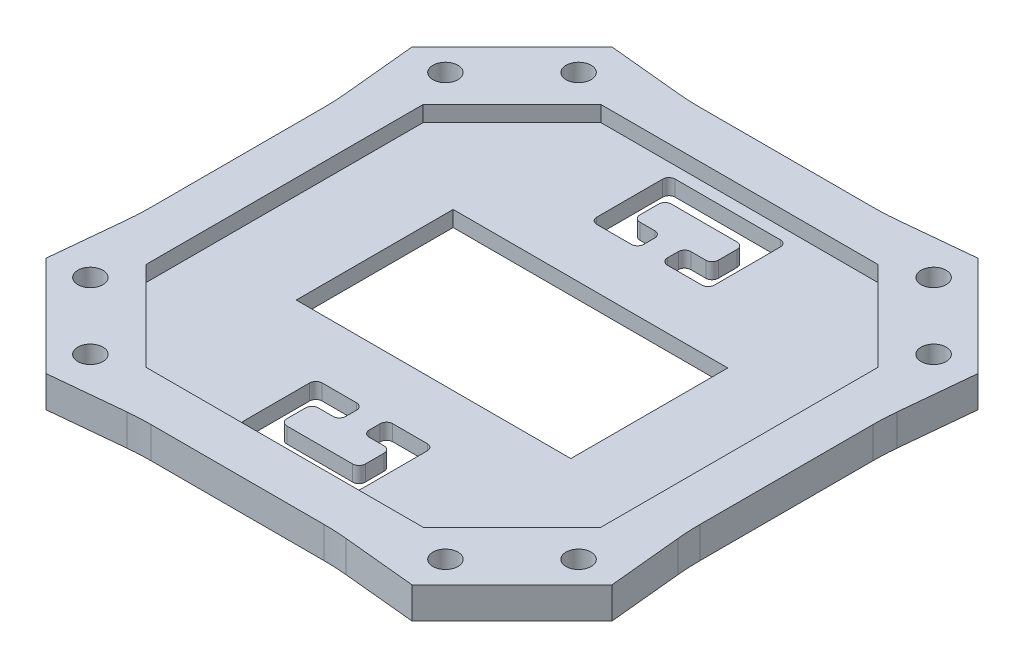
from build123d import *

# Parameters (mm, degrees)
SKETCH1_R           = 1.6
BOSS_EXTRUDE1_DEPTH = 4
CUT_EXTRUDE1_DEPTH  = 2
FILLET2_R           = 30
CUT_EXTRUDE5_DEPTH  = 52.039200621
SKETCH7_W           = 35
SKETCH7_H           = 20
CUT_EXTRUDE6_DEPTH  = 52.039200621


with BuildPart() as part:
    # Sketch1 → Boss-Extrude1 (new body)
    with BuildSketch(Plane(origin=(0, 0, 0), x_dir=(1, 0, 0), z_dir=(0, 1, 0))):
        Polygon((-12.5, 35), (12.5, 35), (23.334523779, 36.062445841), (36.062445841, 23.334523779), (35, 12.5), (35, -12.5), (36.062445841, -23.334523779), (23.334523779, -36.062445841), (12.5, -35), (-12.5, -35), (-23.334523779, -36.062445841), (-36.06244584, -23.334523779), (-35, -12.5), (-35, 12.5), (-36.062445841, 23.334523779), (-23.334523779, 36.062445841), align=None)
        with Locations(Location((22.627416998, 31.112698372, 0), (0, 0, 270))):
            Circle(SKETCH1_R, mode=Mode.SUBTRACT)
        with Locations(Location((31.112698372, 22.627416998, 0), (0, 0, 270))):
            Circle(SKETCH1_R, mode=Mode.SUBTRACT)
        with Locations(Location((22.627416998, -31.112698372, 0), (0, 0, 270))):
            Circle(SKETCH1_R, mode=Mode.SUBTRACT)
        with Locations(Location((31.112698372, -22.627416998, 0), (0, 0, 270))):
            Circle(SKETCH1_R, mode=Mode.SUBTRACT)
        with Locations(Location((-31.112698372, -22.627416998, 0), (0, 0, 270))):
            Circle(SKETCH1_R, mode=Mode.SUBTRACT)
        with Locations(Location((-22.627416998, -31.112698372, 0), (0, 0, 270))):
            Circle(SKETCH1_R, mode=Mode.SUBTRACT)
        with Locations(Location((-22.627416998, 31.112698372, 0), (0, 0, 270))):
            Circle(SKETCH1_R, mode=Mode.SUBTRACT)
        with Locations(Location((-31.112698372, 22.627416998, 0), (0, 0, 270))):
            Circle(SKETCH1_R, mode=Mode.SUBTRACT)
    extrude(amount=BOSS_EXTRUDE1_DEPTH)

    # Sketch2 → Cut-Extrude1 (cut)
    with BuildSketch(Plane(origin=(0, 4, 0), x_dir=(1, 0, 0), z_dir=(0, 1, 0))):
        Polygon((-17.669047558, 29), (17.669047558, 29), (29, 17.669047558), (29, -17.669047558), (17.669047558, -29), (-17.669047558, -29), (-29, -17.669047558), (-29, 17.669047558), align=None)
    extrude(amount=-CUT_EXTRUDE1_DEPTH, mode=Mode.SUBTRACT)

    # Fillet2
    # the kernel refuses this fillet: 30 mm, written as the material it adds along each edge
    with BuildSketch(Plane(origin=(-12.5, 0, -35), x_dir=(1, 0, 0), z_dir=(0, 1, 0))) as fillet2_piece_1:
        with BuildLine():
            CenterArc((FILLET2_R * 0.0489132680017, FILLET2_R), FILLET2_R, 264.399415997, 5.600584003)
            Line((-FILLET2_R * 0.0486797758843, FILLET2_R * 0.00477359471069), (0, 0))
            Line((0, 0), (FILLET2_R * 0.0489132680017, 0))
        make_face()
    extrude(amount=4)
    with BuildSketch(Plane(origin=(12.5, 0, -35), x_dir=(-1, 0, 0), z_dir=(0, 1, 0)), Plane(origin=(35, 0, -12.5), x_dir=(0.09759304388595028, 0, -0.9952264052893065), z_dir=(0, 1, 0)), Plane(origin=(35, 0, 12.5), x_dir=(0, 0, -1), z_dir=(0, 1, 0)), Plane(origin=(12.5, 0, 35), x_dir=(0.9952264052893073, 0, 0.09759304388594116), z_dir=(0, 1, 0)), Plane(origin=(-12.5, 0, 35), x_dir=(1, 0, 0), z_dir=(0, 1, 0)), Plane(origin=(-35, 0, 12.5), x_dir=(-0.09759304388594536, 0, 0.995226405289307), z_dir=(0, 1, 0)), Plane(origin=(-35, 0, -12.5), x_dir=(0, 0, 1), z_dir=(0, 1, 0))) as fillet2_piece_2:
        with BuildLine():
            CenterArc((FILLET2_R * 0.048913268002, -FILLET2_R), FILLET2_R, 90, 5.600584003)
            Line((-FILLET2_R * 0.0486797758846, -FILLET2_R * 0.00477359471075), (0, 0))
            Line((0, 0), (FILLET2_R * 0.048913268002, 0))
        make_face()
    extrude(amount=4)

    # Sketch6 → Cut-Extrude5 (cut, through all)
    with BuildSketch(Plane(origin=(0, 2, 0), x_dir=(1, 0, 0), z_dir=(0, 1, 0))):
        with BuildLine():
            Line((-1.5, 19.7), (-1.5, 18.3))
            ThreePointArc((-1.5, 18.3), (-1.734314575, 17.734314575), (-2.3, 17.5))
            Line((-2.3, 17.5), (-6.7, 17.5))
            ThreePointArc((-6.7, 17.5), (-7.265685425, 17.734314575), (-7.5, 18.3))
            Line((-7.5, 18.3), (-7.5, 26.7))
            ThreePointArc((-7.5, 26.7), (-7.265685425, 27.265685425), (-6.7, 27.5))
            Line((-6.7, 27.5), (6.7, 27.5))
            ThreePointArc((6.7, 27.5), (7.265685425, 27.265685425), (7.5, 26.7))
            Line((7.5, 26.7), (7.5, 18.3))
            ThreePointArc((7.5, 18.3), (7.265685425, 17.734314575), (6.7, 17.5))
            Line((6.7, 17.5), (2.3, 17.5))
            ThreePointArc((2.3, 17.5), (1.734314575, 17.734314575), (1.5, 18.3))
            Line((1.5, 18.3), (1.5, 19.7))
            ThreePointArc((1.5, 19.7), (1.734314575, 20.265685425), (2.3, 20.5))
            Line((2.3, 20.5), (4.2, 20.5))
            ThreePointArc((4.2, 20.5), (4.765685425, 20.734314575), (5, 21.3))
            Line((5, 21.3), (5, 23.7))
            ThreePointArc((5, 23.7), (4.765685425, 24.265685425), (4.2, 24.5))
            Line((4.2, 24.5), (-4.2, 24.5))
            ThreePointArc((-4.2, 24.5), (-4.765685425, 24.265685425), (-5, 23.7))
            Line((-5, 23.7), (-5, 21.3))
            ThreePointArc((-5, 21.3), (-4.765685425, 20.734314575), (-4.2, 20.5))
            Line((-4.2, 20.5), (-2.3, 20.5))
            ThreePointArc((-2.3, 20.5), (-1.734314575, 20.265685425), (-1.5, 19.7))
        make_face()
        with BuildLine():
            Line((-2.3, -17.5), (-6.7, -17.5))
            ThreePointArc((-6.7, -17.5), (-7.265685425, -17.734314575), (-7.5, -18.3))
            Line((-7.5, -18.3), (-7.5, -26.7))
            ThreePointArc((-7.5, -26.7), (-7.265685425, -27.265685425), (-6.7, -27.5))
            Line((-6.7, -27.5), (6.7, -27.5))
            ThreePointArc((6.7, -27.5), (7.265685425, -27.265685425), (7.5, -26.7))
            Line((7.5, -26.7), (7.5, -18.3))
            ThreePointArc((7.5, -18.3), (7.265685425, -17.734314575), (6.7, -17.5))
            Line((6.7, -17.5), (2.3, -17.5))
            ThreePointArc((2.3, -17.5), (1.734314575, -17.734314575), (1.5, -18.3))
            Line((1.5, -18.3), (1.5, -19.7))
            ThreePointArc((1.5, -19.7), (1.734314575, -20.265685425), (2.3, -20.5))
            Line((2.3, -20.5), (4.2, -20.5))
            ThreePointArc((4.2, -20.5), (4.765685425, -20.734314575), (5, -21.3))
            Line((5, -21.3), (5, -23.7))
            ThreePointArc((5, -23.7), (4.765685425, -24.265685425), (4.2, -24.5))
            Line((4.2, -24.5), (-4.2, -24.5))
            ThreePointArc((-4.2, -24.5), (-4.765685425, -24.265685425), (-5, -23.7))
            Line((-5, -23.7), (-5, -21.3))
            ThreePointArc((-5, -21.3), (-4.765685425, -20.734314575), (-4.2, -20.5))
            Line((-4.2, -20.5), (-2.3, -20.5))
            ThreePointArc((-2.3, -20.5), (-1.734314575, -20.265685425), (-1.5, -19.7))
            Line((-1.5, -19.7), (-1.5, -18.3))
            ThreePointArc((-1.5, -18.3), (-1.734314575, -17.734314575), (-2.3, -17.5))
        make_face()
    extrude(amount=-CUT_EXTRUDE5_DEPTH, mode=Mode.SUBTRACT)

    # Sketch7 → Cut-Extrude6 (cut, through all)
    with BuildSketch(Plane(origin=(0, 2, 0), x_dir=(1, 0, 0), z_dir=(0, 1, 0))):
        Rectangle(SKETCH7_W, SKETCH7_H)
    extrude(amount=-CUT_EXTRUDE6_DEPTH, mode=Mode.SUBTRACT)


solid = part.part
